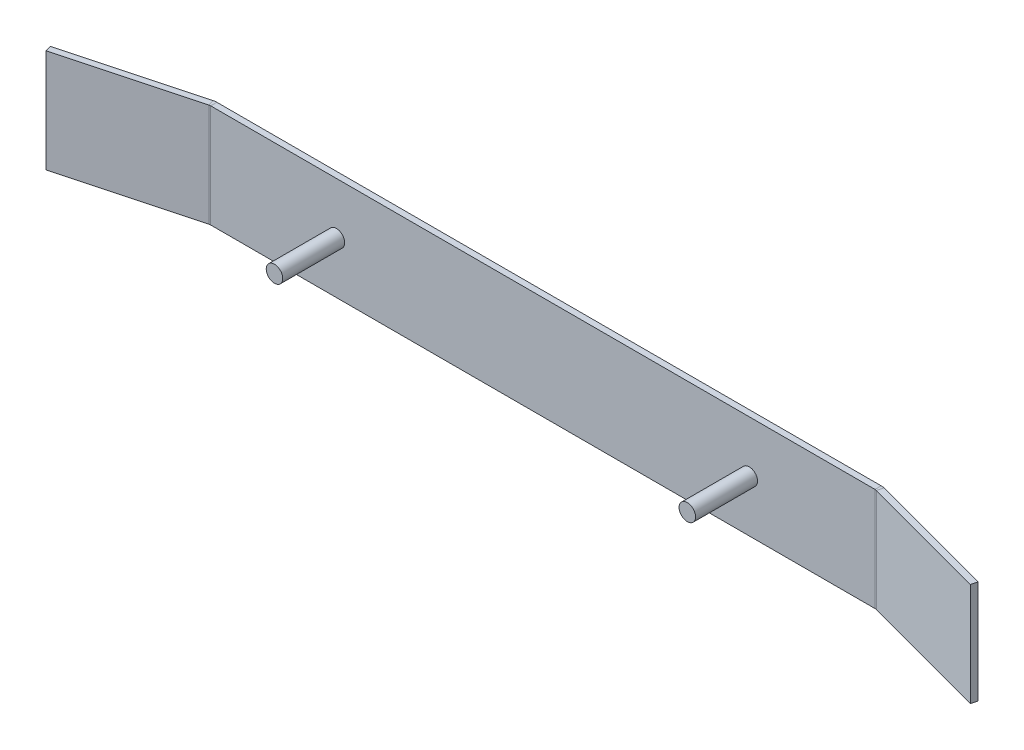
from build123d import *

# Parameters (mm, degrees)
SKETCH1_W              = 453
SKETCH1_H              = 50
BASE_FLANGE1_DEPTH     = 3
SKETCHED_START         = -25
SKETCHED_BEND1_DEPTH   = 50
SKETCHED_BEND1_2_DEPTH = 50
SKETCH7_R              = 4
BOSS_EXTRUDE1_DEPTH    = 30


# Read off the part's stored shape, not the designer's step: Sketched Bend1
# Sheet-metal steps are written as plain solids
with BuildPart() as part:
    # Sketch1 → Base-Flange1 (new body)
    with BuildSketch(Plane.XY):
        Rectangle(SKETCH1_W, SKETCH1_H)
    extrude(amount=-BASE_FLANGE1_DEPTH)

    # Sketched Bend1 outline → Sketched Bend1 (cut)
    with BuildSketch(Plane(origin=(0, 0, 0), x_dir=(1, 0, 0), z_dir=(0, 1, 0)).offset(SKETCHED_START)):
        with BuildLine():
            ThreePointArc((-162.463865648, 2.795554958), (-161.69410853, 2.948669168), (-160.910951377, 3))
            Line((-160.910951377, 3), (-226.5, 3))
            Line((-226.5, 3), (-226.5, 0))
            Line((-226.5, 0), (-172.897018786, 0))
            Line((-172.897018786, 0), (-162.463865648, 2.795554958))
        make_face()
        with BuildLine():
            Line((226.5, 3), (160.910951377, 3))
            ThreePointArc((160.910951377, 3), (161.69410853, 2.948669168), (162.463865648, 2.795554958))
            Line((162.463865648, 2.795554958), (172.897018786, 0))
            Line((172.897018786, 0), (226.5, 0))
            Line((226.5, 0), (226.5, 3))
        make_face()
    extrude(amount=SKETCHED_BEND1_DEPTH, mode=Mode.SUBTRACT)

    # Sketched Bend1 2 outline → Sketched Bend1 2 (add)
    with BuildSketch(Plane(origin=(0, 0, 0), x_dir=(1, 0, 0), z_dir=(0, 1, 0)).offset(SKETCHED_START)):
        with BuildLine():
            Line((-160.910951377, 0), (-172.897018786, 0))
            Line((-172.897018786, 0), (-224.680067079, -13.875225972))
            Line((-224.680067079, -13.875225972), (-223.903609944, -16.773003451))
            Line((-223.903609944, -16.773003451), (-161.687408513, -0.102222521))
            ThreePointArc((-161.687408513, -0.102222521), (-161.302529954, -0.025665416), (-160.910951377, 0))
        make_face()
        with BuildLine():
            Line((224.680067079, -13.875225972), (172.897018786, 0))
            Line((172.897018786, 0), (160.910951377, 0))
            ThreePointArc((160.910951377, 0), (161.302529954, -0.025665416), (161.687408513, -0.102222521))
            Line((161.687408513, -0.102222521), (223.903609944, -16.773003451))
            Line((223.903609944, -16.773003451), (224.680067079, -13.875225972))
        make_face()
    extrude(amount=SKETCHED_BEND1_2_DEPTH)

    # Sketch7 → Boss-Extrude1 (add)
    with BuildSketch(Plane.XY):
        with Locations(Location((-100, 0, 0), (0, 0, 180))):
            Circle(SKETCH7_R)
        with Locations(Location((100, 0, 0), (0, 0, 180))):
            Circle(SKETCH7_R)
    extrude(amount=BOSS_EXTRUDE1_DEPTH)


solid = part.part
